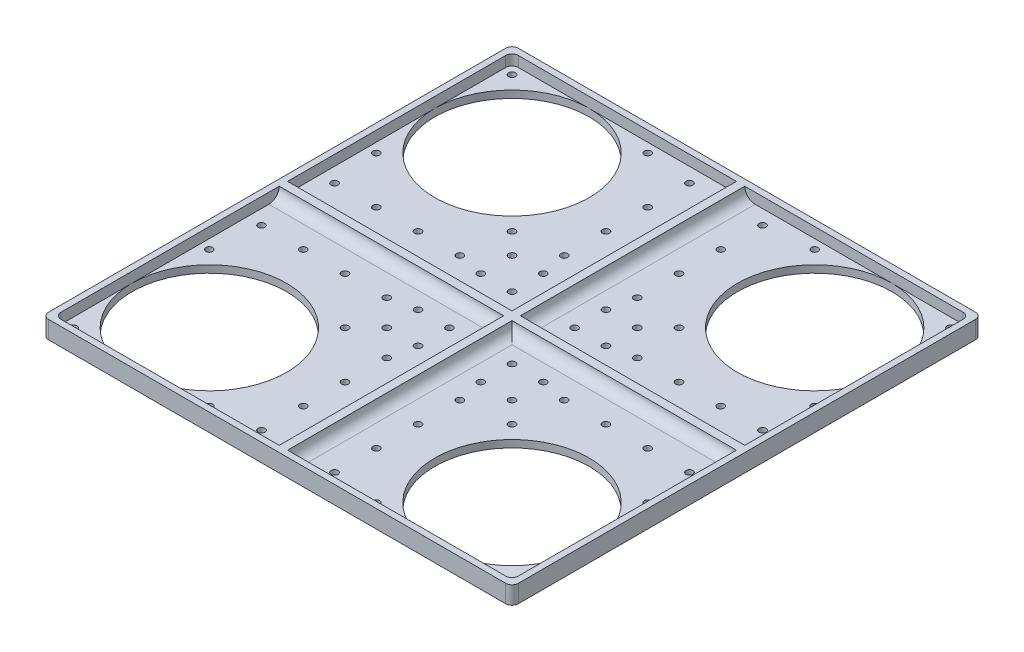
from build123d import *

# Parameters (mm, degrees)
SKETCH_1_W               = 225
SKETCH_1_H               = 225
EXTRUDE_1_DEPTH          = 3.5
SKETCH_2_R               = 37
CUT_EXTRUDE_1_DEPTH      = 8
SKETCH_4_R               = 1.65
CUT_EXTRUDE_2_DEPTH      = 160.137519146
SKETCH_3_W               = 225
SKETCH_3_H               = 225
SKETCH_3_W_2             = 219
SKETCH_3_H_2             = 219
EXTRUDE_1975_DEPTH       = 5
SKETCH_5_R               = 1.65
CUT_EXTRUDE_2992_DEPTH   = 10
MIRROR_2_COPY_1_SKETCH_R = 37
MIRROR_2_COPY_1_DEPTH    = 8
MIRROR_2_COPY_2_SKETCH_R = 1.65
MIRROR_2_COPY_2_DEPTH    = 160.137519146
FILLET_1_R               = 5
FILLET_2_R               = 3
SKETCH_6_R               = 1.65
CUT_EXTRUDE_3_DEPTH      = 10


with BuildPart() as part:
    # 草图1 → 凸台-拉伸1 (new body)
    with BuildSketch(Plane(origin=(0, 0, 0), x_dir=(1, 0, 0), z_dir=(0, 1, 0))):
        Rectangle(SKETCH_1_W, SKETCH_1_H)
    extrude(amount=EXTRUDE_1_DEPTH)

    # 草图2 → 切除-拉伸1 (cut)
    with BuildSketch(Plane(origin=(0, 3.5, 0), x_dir=(1, 0, 0), z_dir=(0, 1, 0))):
        with Locations(Location((-72.5, -72.5, 0), (0, 0, 270))):
            Circle(SKETCH_2_R)
    cut_extrude_1 = extrude(amount=-CUT_EXTRUDE_1_DEPTH, mode=Mode.SUBTRACT)

    # 草图4 → 切除-拉伸2 (cut, through all)
    with BuildSketch(Plane.XZ):
        with Locations(Location((-40, 40, 0), (0, 0, 270))):
            Circle(SKETCH_4_R)
        with Locations(Location((-105, 40, 0), (0, 0, 270))):
            Circle(SKETCH_4_R)
        with Locations(Location((-105, 105, 0), (0, 0, 270))):
            Circle(SKETCH_4_R)
        with Locations(Location((-40, 105, 0), (0, 0, 270))):
            Circle(SKETCH_4_R)
    cut_extrude_2 = extrude(amount=-CUT_EXTRUDE_2_DEPTH, mode=Mode.SUBTRACT)

    # 草图3 → Extrude 1975 (add)
    # profile 1 of 2: a face of its own
    with BuildSketch(Plane(origin=(0, 3.5, 0), x_dir=(1, 0, 0), z_dir=(0, 1, 0))):
        Rectangle(SKETCH_3_W, SKETCH_3_H)
        Rectangle(SKETCH_3_W_2, SKETCH_3_H_2, mode=Mode.SUBTRACT)
    # profile 2 of 2: a face of its own
    with BuildSketch(Plane(origin=(0, 3.5, 0), x_dir=(1, 0, 0), z_dir=(0, 1, 0))):
        Polygon((2, 109.5), (2, 2), (109.5, 2), (109.5, -2), (2, -2), (2, -109.5), (-2, -109.5), (-2, -2), (-109.5, -2), (-109.5, 2), (-2, 2), (-2, 109.5), align=None)
    extrude(amount=EXTRUDE_1975_DEPTH)

    # 草图5 → Cut-Extrude 2992 (cut)
    with BuildSketch(Plane.XZ):
        with Locations(Location((-102.5, 17.5, 0), (0, 0, 270))):
            Circle(SKETCH_5_R)
        with Locations(Location((-102.5, -17.5, 0), (0, 0, 270))):
            Circle(SKETCH_5_R)
        with Locations(Location((-82.5, 17.5, 0), (0, 0, 270))):
            Circle(SKETCH_5_R)
        with Locations(Location((-82.5, -17.5, 0), (0, 0, 270))):
            Circle(SKETCH_5_R)
        with Locations(Location((-62.5, 17.5, 0), (0, 0, 270))):
            Circle(SKETCH_5_R)
        with Locations(Location((-62.5, -17.5, 0), (0, 0, 270))):
            Circle(SKETCH_5_R)
        with Locations(Location((-42.5, 17.5, 0), (0, 0, 270))):
            Circle(SKETCH_5_R)
        with Locations(Location((-42.5, -17.5, 0), (0, 0, 270))):
            Circle(SKETCH_5_R)
        with Locations(Location((17.5, 42.5, 0), (0, 0, 270))):
            Circle(SKETCH_5_R)
        with Locations(Location((-17.5, 42.5, 0), (0, 0, 270))):
            Circle(SKETCH_5_R)
        with Locations(Location((-17.5, 62.5, 0), (0, 0, 270))):
            Circle(SKETCH_5_R)
        with Locations(Location((17.5, 62.5, 0), (0, 0, 270))):
            Circle(SKETCH_5_R)
        with Locations(Location((17.5, 82.5, 0), (0, 0, 270))):
            Circle(SKETCH_5_R)
        with Locations(Location((-17.5, 82.5, 0), (0, 0, 270))):
            Circle(SKETCH_5_R)
        with Locations(Location((-17.5, 102.5, 0), (0, 0, 270))):
            Circle(SKETCH_5_R)
        with Locations(Location((17.5, 102.5, 0), (0, 0, 270))):
            Circle(SKETCH_5_R)
        with Locations(Location((42.5, -17.5, 0), (0, 0, 270))):
            Circle(SKETCH_5_R)
        with Locations(Location((42.5, 17.5, 0), (0, 0, 270))):
            Circle(SKETCH_5_R)
        with Locations(Location((62.5, 17.5, 0), (0, 0, 270))):
            Circle(SKETCH_5_R)
        with Locations(Location((62.5, -17.5, 0), (0, 0, 270))):
            Circle(SKETCH_5_R)
        with Locations(Location((82.5, -17.5, 0), (0, 0, 270))):
            Circle(SKETCH_5_R)
        with Locations(Location((82.5, 17.5, 0), (0, 0, 270))):
            Circle(SKETCH_5_R)
        with Locations(Location((102.5, 17.5, 0), (0, 0, 270))):
            Circle(SKETCH_5_R)
        with Locations(Location((102.5, -17.5, 0), (0, 0, 270))):
            Circle(SKETCH_5_R)
        with Locations(Location((-17.5, -42.5, 0), (0, 0, 270))):
            Circle(SKETCH_5_R)
        with Locations(Location((17.5, -42.5, 0), (0, 0, 270))):
            Circle(SKETCH_5_R)
        with Locations(Location((17.5, -62.5, 0), (0, 0, 270))):
            Circle(SKETCH_5_R)
        with Locations(Location((-17.5, -62.5, 0), (0, 0, 270))):
            Circle(SKETCH_5_R)
        with Locations(Location((-17.5, -82.5, 0), (0, 0, 270))):
            Circle(SKETCH_5_R)
        with Locations(Location((17.5, -82.5, 0), (0, 0, 270))):
            Circle(SKETCH_5_R)
        with Locations(Location((17.5, -102.5, 0), (0, 0, 270))):
            Circle(SKETCH_5_R)
        with Locations(Location((-17.5, -102.5, 0), (0, 0, 270))):
            Circle(SKETCH_5_R)
    extrude(amount=-CUT_EXTRUDE_2992_DEPTH, mode=Mode.SUBTRACT)

    # 镜向1: 切除-拉伸1, 切除-拉伸2 across plane
    add(cut_extrude_1.mirror(Plane(origin=(0, 0, 0), x_dir=(0, 0, 1), z_dir=(1, 0, 0))), mode=Mode.SUBTRACT)
    add(cut_extrude_2.mirror(Plane(origin=(0, 0, 0), x_dir=(0, 0, 1), z_dir=(1, 0, 0))), mode=Mode.SUBTRACT)

    # 镜向2: 切除-拉伸1, 切除-拉伸2 across plane
    add(cut_extrude_1.mirror(Plane.XY), mode=Mode.SUBTRACT)
    add(cut_extrude_2.mirror(Plane.XY), mode=Mode.SUBTRACT)

    # 镜向2 copy 1 sketch → 镜向2 copy 1 (cut)
    with BuildSketch(Plane(origin=(0, 3.5, 0), x_dir=(-1, 0, 0), z_dir=(0, 1, 0))):
        with Locations(Location((-72.5, -72.5, 0), (0, 0, 270))):
            Circle(MIRROR_2_COPY_1_SKETCH_R)
    extrude(amount=-MIRROR_2_COPY_1_DEPTH, mode=Mode.SUBTRACT)

    # 镜向2 copy 2 sketch → 镜向2 copy 2 (cut, through all)
    with BuildSketch(Plane(origin=(0, 0, 0), x_dir=(-1, 0, 0), z_dir=(0, -1, 0))):
        with Locations(Location((-40, 40, 0), (0, 0, 270))):
            Circle(MIRROR_2_COPY_2_SKETCH_R)
        with Locations(Location((-105, 40, 0), (0, 0, 270))):
            Circle(MIRROR_2_COPY_2_SKETCH_R)
        with Locations(Location((-105, 105, 0), (0, 0, 270))):
            Circle(MIRROR_2_COPY_2_SKETCH_R)
        with Locations(Location((-40, 105, 0), (0, 0, 270))):
            Circle(MIRROR_2_COPY_2_SKETCH_R)
    extrude(amount=-MIRROR_2_COPY_2_DEPTH, mode=Mode.SUBTRACT)

    # 圆角1
    fillet_1_edges = [part.edges().sort_by_distance(p)[0] for p in [
        (-55.75, 3.5, -2),
        (55.75, 3.5, -2),
        (55.75, 3.5, 2),
        (-55.75, 3.5, 2),
        (-2, 3.5, 55.75),
        (2, 3.5, 55.75),
        (2, 3.5, -55.75),
        (-2, 3.5, -55.75),
    ]]
    fillet(fillet_1_edges, radius=FILLET_1_R - 0.0001)  # a hair under: the kernel refuses the full size

    # 圆角2
    fillet_2_edges = [part.edges().sort_by_distance(p)[0] for p in [
        (109.5, 6, 109.5),
        (-109.5, 6, 109.5),
        (-109.5, 6, -109.5),
        (109.5, 6, -109.5),
        (112.5, 4.25, 112.5),
        (-112.5, 4.25, 112.5),
        (-112.5, 4.25, -112.5),
        (112.5, 4.25, -112.5),
    ]]
    fillet(fillet_2_edges, radius=FILLET_2_R)

    # 草图6 → 切除-拉伸3 (cut)
    with BuildSketch(Plane.XZ):
        with Locations(Location((-30, 30, 0), (0, 0, 270))):
            Circle(SKETCH_6_R)
        with Locations(Location((-15, 30, 0), (0, 0, 270))):
            Circle(SKETCH_6_R)
        with Locations(Location((15, 30, 0), (0, 0, 270))):
            Circle(SKETCH_6_R)
        with Locations(Location((30, 30, 0), (0, 0, 270))):
            Circle(SKETCH_6_R)
        with Locations(Location((-15, 15, 0), (0, 0, 270))):
            Circle(SKETCH_6_R)
        with Locations(Location((15, 15, 0), (0, 0, 270))):
            Circle(SKETCH_6_R)
        with Locations(Location((30, 15, 0), (0, 0, 270))):
            Circle(SKETCH_6_R)
        with Locations(Location((-15, -15, 0), (0, 0, 270))):
            Circle(SKETCH_6_R)
        with Locations(Location((15, -15, 0), (0, 0, 270))):
            Circle(SKETCH_6_R)
        with Locations(Location((30, -15, 0), (0, 0, 270))):
            Circle(SKETCH_6_R)
        with Locations(Location((-15, -30, 0), (0, 0, 270))):
            Circle(SKETCH_6_R)
        with Locations(Location((15, -30, 0), (0, 0, 270))):
            Circle(SKETCH_6_R)
        with Locations(Location((30, -30, 0), (0, 0, 270))):
            Circle(SKETCH_6_R)
        with Locations(Location((-30, 15, 0), (0, 0, 270))):
            Circle(SKETCH_6_R)
        with Locations(Location((-30, -15, 0), (0, 0, 270))):
            Circle(SKETCH_6_R)
        with Locations(Location((-30, -30, 0), (0, 0, 270))):
            Circle(SKETCH_6_R)
    extrude(amount=-CUT_EXTRUDE_3_DEPTH, mode=Mode.SUBTRACT)


solid = part.part
